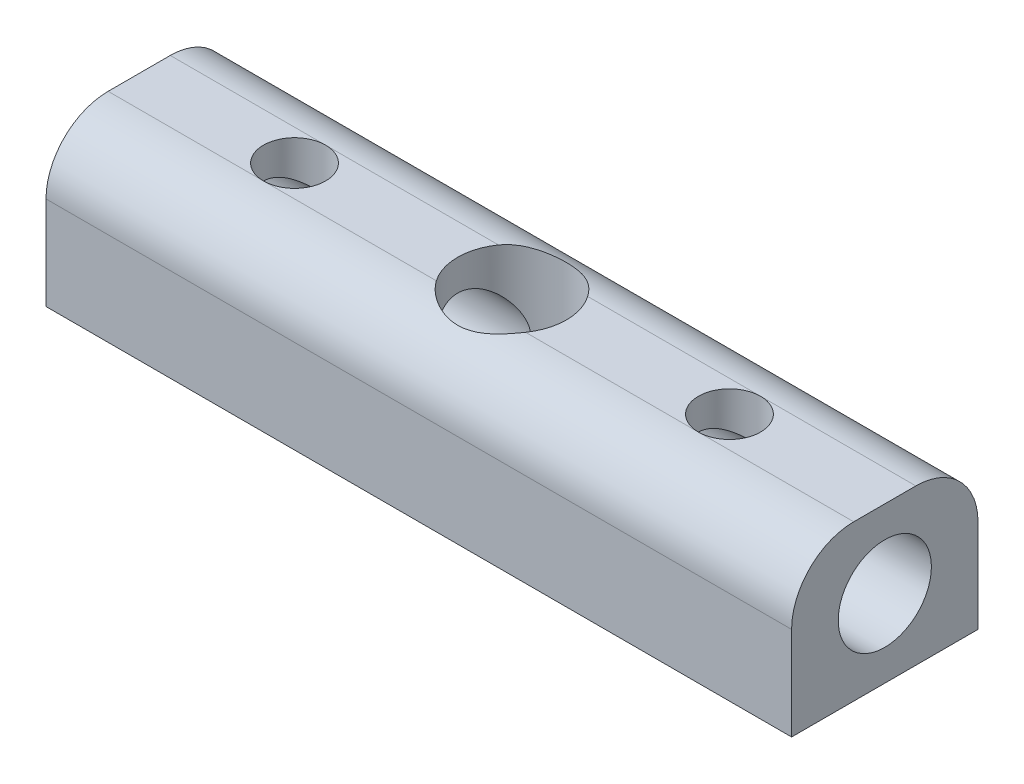
from build123d import *

# Parameters (mm, degrees)
SKETCH_1_W          = 24
SKETCH_1_H          = 5
EXTRUDE_1_DEPTH     = 3
SKETCH_2_R          = 1.5
CUT_EXTRUDE_1_DEPTH = 25.315632832
SKETCH_3_R          = 1.75
CUT_EXTRUDE_2_DEPTH = 14.341664064
SKETCH_4_R          = 1
CUT_EXTRUDE_3_DEPTH = 14.341664192
SKETCH_5_R          = 1
EXTRUDE_3_DEPTH     = 2
SKETCH_6_W          = 2
SKETCH_6_H          = 0.5
CUT_EXTRUDE_7_DEPTH = 3
CUT_EXTRUDE_START   = -10
SKETCH_8_R          = 1
CUT_EXTRUDE_9_DEPTH = 10
FILLET_2_R          = 2


with BuildPart() as part:
    # 草图1 → 凸台-拉伸1 (new, symmetric)
    with BuildSketch(Plane.XY):
        Rectangle(SKETCH_1_W, SKETCH_1_H)
    extrude(amount=EXTRUDE_1_DEPTH, both=True)

    # 草图2 → 切除-拉伸1 (cut, through all)
    with BuildSketch(Plane(origin=(12, 0, 0), x_dir=(0, 0, -1), z_dir=(1, 0, 0))):
        Circle(SKETCH_2_R)
    extrude(amount=-CUT_EXTRUDE_1_DEPTH, mode=Mode.SUBTRACT)

    # 草图3 → 切除-拉伸2 (cut, through all)
    with BuildSketch(Plane(origin=(0, 2.5, 0), x_dir=(1, 0, 0), z_dir=(0, 1, 0))):
        with Locations(Location((0, 0, 0), (0, 0, 270))):
            Circle(SKETCH_3_R)
    extrude(amount=-CUT_EXTRUDE_2_DEPTH, mode=Mode.SUBTRACT)

    # 草图4 → 切除-拉伸3 (cut, through all)
    with BuildSketch(Plane(origin=(0, 2.5, 0), x_dir=(1, 0, 0), z_dir=(0, 1, 0))):
        with Locations(Location((-7, 0, 0), (0, 0, 270))):
            Circle(SKETCH_4_R)
    extrude(amount=-CUT_EXTRUDE_3_DEPTH, mode=Mode.SUBTRACT)

    # 草图5 → 凸台-拉伸3 (add)
    with BuildSketch(Plane(origin=(0, 2.5, 0), x_dir=(1, 0, 0), z_dir=(0, 1, 0))):
        with Locations(Location((7, 0, 0), (0, 0, 270))):
            Circle(SKETCH_5_R)
    extrude(amount=EXTRUDE_3_DEPTH)

    # 草图6 → 切除-拉伸7 (cut)
    with BuildSketch(Plane(origin=(0, 0, -3), x_dir=(-1, 0, 0), z_dir=(0, 0, -1))):
        with Locations((-7, 3.25)):
            Rectangle(SKETCH_6_W, SKETCH_6_H)
    extrude(amount=-CUT_EXTRUDE_7_DEPTH, mode=Mode.SUBTRACT)

    # 草图8 → 切除-拉伸9 (cut)
    with BuildSketch(Plane(origin=(0, 4.5, 0), x_dir=(1, 0, 0), z_dir=(0, 1, 0)).offset(CUT_EXTRUDE_START)):
        with Locations(Location((7, 0, 0), (0, 0, 270))):
            Circle(SKETCH_8_R)
    extrude(amount=CUT_EXTRUDE_9_DEPTH, mode=Mode.SUBTRACT)

    # 圆角2
    # the kernel refuses this fillet: 2 mm, written as the material it takes off along each edge
    with BuildSketch(Plane(origin=(17, 2.5, -3), x_dir=(0, -1, 0), z_dir=(-1, 0, 0))) as fillet_2_piece_1:
        with BuildLine():
            CenterArc((FILLET_2_R, FILLET_2_R), FILLET_2_R, 180, 90)
            Line((0, FILLET_2_R), (0, 0))
            Line((0, 0), (FILLET_2_R, 0))
        make_face()
    extrude(amount=34, mode=Mode.SUBTRACT)
    with BuildSketch(Plane(origin=(17, 2.5, 3), x_dir=(0, -1, 0), z_dir=(-1, 0, 0))) as fillet_2_piece_2:
        with BuildLine():
            CenterArc((FILLET_2_R, -FILLET_2_R), FILLET_2_R, 90, 90)
            Line((0, -FILLET_2_R), (0, 0))
            Line((0, 0), (FILLET_2_R, 0))
        make_face()
    extrude(amount=34, mode=Mode.SUBTRACT)


solid = part.part
